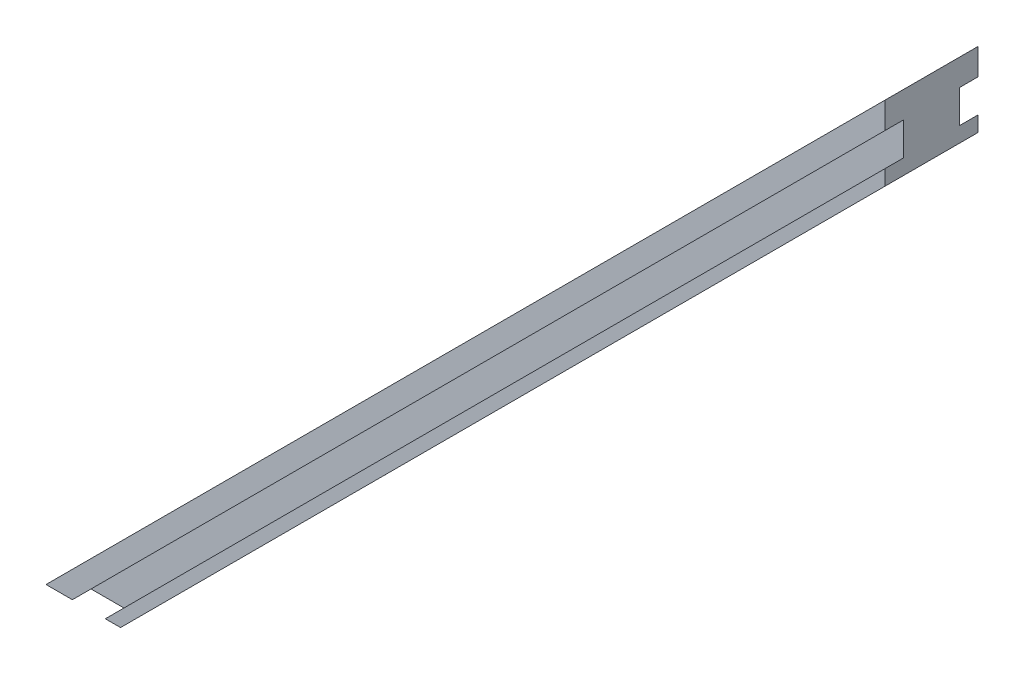
from build123d import *

# Parameters (mm, degrees)
MAIN_DEPTH         = 5
WINDOWSLOT1_DEPTH  = 2
SKETCH6_R          = 1.25
CUT_EXTRUDE2_DEPTH = 5
LPATTERN1_COUNT    = 11
LPATTERN1_PITCH    = 10
SKETCH7_R          = 3.5
CUT_EXTRUDE4_DEPTH = 1.5


with BuildPart() as part:
    # Sketch1 → Main (new, symmetric)
    with BuildSketch(Plane.XY):
        Polygon((-45, -45), (45, 45), (45, 37), (-37, -45), align=None)
    extrude(amount=MAIN_DEPTH, both=True)

    # Sketch4 → WindowSlot1 (cut)
    with BuildSketch(Plane.XY.offset(5)):
        Polygon((45, 42.171572875), (-42.171572875, -45), (-38.636038969, -45), (45, 38.636038969), align=None)
    windowslot1 = extrude(amount=-WINDOWSLOT1_DEPTH, mode=Mode.SUBTRACT)

    # Mirror1: WindowSlot1 across plane
    add(windowslot1.mirror(Plane.XY), mode=Mode.SUBTRACT)

    # Sketch6 → Cut-Extrude2 (cut)
    with BuildSketch(Plane(origin=(4, -4, 0), x_dir=(0, 0, 1), z_dir=(-0.7071067811865495, 0.7071067811865456, 0))):
        with Locations((0, 50)):
            Circle(SKETCH6_R)
    cut_extrude2 = extrude(amount=CUT_EXTRUDE2_DEPTH, mode=Mode.SUBTRACT)

    # LPattern1: Cut-Extrude2 ×11
    with Locations(*[Vector(-0.7071067811865458, -0.7071067811865493, 0) * (i * LPATTERN1_PITCH) for i in range(1, LPATTERN1_COUNT)]):
        add(cut_extrude2, mode=Mode.SUBTRACT)

    # Sketch7 → Cut-Extrude4 (cut)
    with BuildSketch(Plane(origin=(0, 0, 0), x_dir=(0, 0, 1), z_dir=(-0.7071067811865493, 0.7071067811865458, 0))):
        with Locations((0, 40)):
            Circle(SKETCH7_R)
        with Locations((0, -40)):
            Circle(SKETCH7_R)
    extrude(amount=-CUT_EXTRUDE4_DEPTH, mode=Mode.SUBTRACT)


solid = part.part
